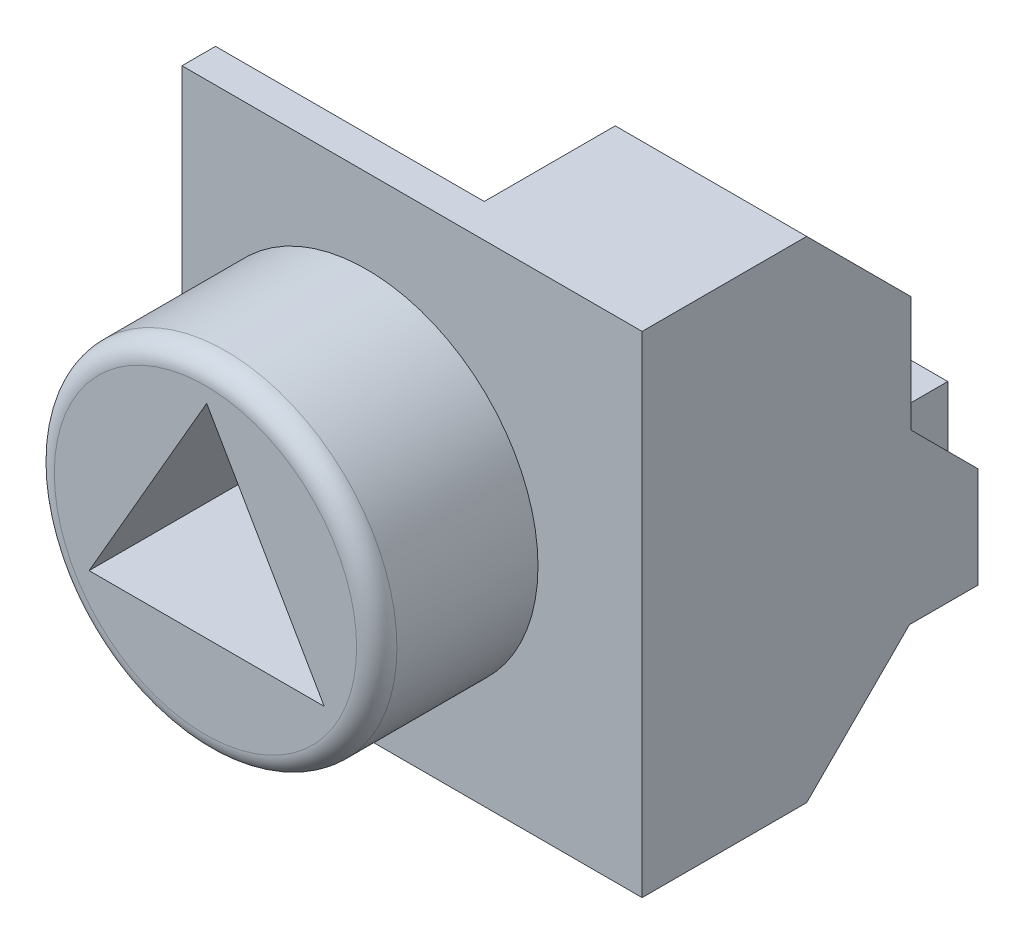
from build123d import *

# Parameters (mm, degrees)
SKETCH_2_R          = 5.1
EXTRUDE_1_DEPTH     = 4.8
SKETCH_3_W          = 11
SKETCH_3_H          = 14.6
EXTRUDE_2_DEPTH     = 1
SKETCH_4_R          = 1.5
EXTRUDE_3_DEPTH     = 10.8
CUT_EXTRUDE_1_DEPTH = 10.8
FILLET_1_R          = 0.6
CUT_EXTRUDE_2_DEPTH = 4.8
SKETCH_7_R          = 1
CUT_EXTRUDE_3_DEPTH = 1
SKETCH_8_W          = 3
SKETCH_8_H          = 14.6
EXTRUDE_4_DEPTH     = 7
CHAMFER_1_SIZE      = 3.1
SKETCH_9_W          = 2.584868303
SKETCH_9_H          = 3
EXTRUDE_5_DEPTH     = 10
CHAMFER_3_SIZE      = 2
CHAMFER_4_SIZE      = 2
EXTRUDE_6_DEPTH     = 2.7


with BuildPart() as part:
    # Эскиз2 → Бобышка-Вытянуть1 (new body)
    with BuildSketch(Plane.XY):
        with Locations((0, 9.48)):
            Circle(SKETCH_2_R)
    extrude(amount=EXTRUDE_1_DEPTH)

    # Эскиз3 → Бобышка-Вытянуть2 (add)
    with BuildSketch(Plane(origin=(0, 0, 0), x_dir=(-1, 0, 0), z_dir=(0, 0, -1))):
        with Locations((0, 9.78)):
            Rectangle(SKETCH_3_W, SKETCH_3_H)
    extrude(amount=EXTRUDE_2_DEPTH)

    # Эскиз4 → Бобышка-Вытянуть3 (add)
    with BuildSketch(Plane(origin=(0, 0, -1), x_dir=(-1, 0, 0), z_dir=(0, 0, -1))):
        with Locations(Location((-4.415131697, 7.038465404, 0), (0, 0, 223.676907922))):
            Circle(SKETCH_4_R)
    extrude(amount=EXTRUDE_3_DEPTH)

    # Эскиз5 → Вырез-Вытянуть1 (cut)
    with BuildSketch(Plane.XY.offset(-1)):
        with BuildLine():
            Line((5.5, 8.074351868), (5.5, 6.002578941))
            ThreePointArc((5.5, 6.002578941), (5.915131697, 7.038465404), (5.5, 8.074351868))
        make_face()
    extrude(amount=-CUT_EXTRUDE_1_DEPTH, mode=Mode.SUBTRACT)

    # Скругление1
    fillet_1_edges = [part.edges().sort_by_distance(p)[0] for p in [
        (-5.1, 9.48, 4.8),
    ]]
    fillet(fillet_1_edges, radius=FILLET_1_R)

    # Эскиз6 → Вырез-Вытянуть2 (cut)
    with BuildSketch(Plane.XY.offset(4.8)):
        Polygon((0.035898385, 13.542177826), (-3.464101615, 7.48), (3.535898385, 7.48), align=None)
    extrude(amount=-CUT_EXTRUDE_2_DEPTH, mode=Mode.SUBTRACT)

    # Эскиз7 → Вырез-Вытянуть3 (cut)
    with BuildSketch(Plane.XY):
        with Locations((0, 9.48)):
            Circle(SKETCH_7_R)
    extrude(amount=-CUT_EXTRUDE_3_DEPTH, mode=Mode.SUBTRACT)

    # Эскиз8 → Бобышка-Вытянуть4 (add)
    with BuildSketch(Plane(origin=(0, 0, -1), x_dir=(-1, 0, 0), z_dir=(0, 0, -1))):
        with Locations((-4, 9.78)):
            Rectangle(SKETCH_8_W, SKETCH_8_H)
    extrude(amount=EXTRUDE_4_DEPTH)

    # Фаска1
    # the kernel refuses this chamfer: 3.1 mm, written as the material it takes off along each edge
    with BuildSketch(Plane(origin=(-5.472217263, 2.48, -8), x_dir=(0, -0.027495876610586382, 0.9996219169112966), z_dir=(1, 0, 0))) as chamfer_1_piece_1_section:
        Polygon((CHAMFER_1_SIZE * 0.999621916911, -CHAMFER_1_SIZE * 0.0274958766106), (-CHAMFER_1_SIZE * 0.0274958766106, -CHAMFER_1_SIZE * 0.999621916911), (0, 0), align=None)
    chamfer_1_piece_1 = extrude(amount=18.944434525, mode=Mode.PRIVATE)
    chamfer_1_piece_1 = chamfer_1_piece_1 - Plane(origin=(4.415131697, 7.038465404, -6.977511347), x_dir=(0.7232455354515278, -0.6905909755053515, 0), z_dir=(0, 0, 1)) * Cylinder(1.5, 51, mode=Mode.PRIVATE)
    add(chamfer_1_piece_1, mode=Mode.SUBTRACT)
    with BuildSketch(Plane(origin=(13.472217263, 17.08, -8), x_dir=(0, -0.9996219169112966, -0.027495876610586514), z_dir=(-1, 0, 0))) as chamfer_1_piece_2:
        Polygon((CHAMFER_1_SIZE * 0.999621916911, CHAMFER_1_SIZE * 0.0274958766106), (-CHAMFER_1_SIZE * 0.0274958766106, CHAMFER_1_SIZE * 0.999621916911), (0, 0), align=None)
    extrude(amount=18.944434525, mode=Mode.SUBTRACT)

    # Эскиз9 → Бобышка-Вытянуть5 (add)
    with BuildSketch(Plane(origin=(0, 0, -11.8), x_dir=(-1, 0, 0), z_dir=(0, 0, -1))):
        with Locations((-4.207565848, 7.038465404)):
            Rectangle(SKETCH_9_W, SKETCH_9_H)
    extrude(amount=-EXTRUDE_5_DEPTH)

    # Фаска3
    chamfer_3_edges = [part.edges().sort_by_distance(p)[0] for p in [
        (4.207565848, 8.538465404, -8),
    ]]
    chamfer(chamfer_3_edges, length=CHAMFER_3_SIZE)

    # Фаска4
    # the kernel refuses this chamfer: 2 mm, written as the material it adds along each edge
    with BuildSketch(Plane(origin=(2.915131697, 15.68183138, -8), x_dir=(-0.9996219169112968, 6.965053790802993e-15, 0.027495876610586487), z_dir=(0, -1, 0))) as chamfer_4_piece_1_section:
        Polygon((CHAMFER_4_SIZE * 0.999621916911, CHAMFER_4_SIZE * 0.0274958766106), (-CHAMFER_4_SIZE * 0.0274958766106, CHAMFER_4_SIZE * 0.999621916911), (0, 0), align=None)
    chamfer_4_piece_1 = extrude(amount=15.245197356, mode=Mode.PRIVATE)
    chamfer_4_piece_1 = split(chamfer_4_piece_1, bisect_by=Plane(origin=(2.5, 9.220354444, -8.636221921), z_dir=(1, 0, 0)), keep=Keep.TOP, mode=Mode.PRIVATE)
    chamfer_4_piece_1 = split(chamfer_4_piece_1, bisect_by=Plane(origin=(2.728922141, 9.561298963, -8.977166441), z_dir=(0, -0.7071067811865476, 0.7071067811865476)), keep=Keep.TOP, mode=Mode.PRIVATE)
    chamfer_4_piece_1 = split(chamfer_4_piece_1, bisect_by=Plane(origin=(2.728922141, 8.538465404, -8.636221921), z_dir=(0, 1, 0)), keep=Keep.TOP, mode=Mode.PRIVATE)
    add(chamfer_4_piece_1)
    with BuildSketch(Plane(origin=(2.915131697, 15.68183138, -8), x_dir=(-0.9996219169112968, 6.965053790802993e-15, 0.027495876610586487), z_dir=(0, -1, 0))) as chamfer_4_piece_2_section:
        Polygon((CHAMFER_4_SIZE * 0.999621916911, CHAMFER_4_SIZE * 0.0274958766106), (-CHAMFER_4_SIZE * 0.0274958766106, CHAMFER_4_SIZE * 0.999621916911), (0, 0), align=None)
    chamfer_4_piece_2 = extrude(amount=15.245197356, mode=Mode.PRIVATE)
    chamfer_4_piece_2 = split(chamfer_4_piece_2, bisect_by=Plane(origin=(2.5, 7.443880943, -8.769342974), z_dir=(1, 0, 0)), keep=Keep.TOP, mode=Mode.PRIVATE)
    chamfer_4_piece_2 = split(chamfer_4_piece_2, bisect_by=Plane(origin=(2.735166787, 6.896611958, -9.316611958), z_dir=(0, 0.7071067811862648, 0.7071067811868302)), keep=Keep.TOP, mode=Mode.PRIVATE)
    chamfer_4_piece_2 = split(chamfer_4_piece_2, bisect_by=Plane(origin=(2.735166787, 8.606501686, -9.931963718), z_dir=(0, -0.7071067811865476, 0.7071067811865476)), keep=Keep.TOP, mode=Mode.PRIVATE)
    chamfer_4_piece_2 = split(chamfer_4_piece_2, bisect_by=Plane(origin=(2.735166787, 8.538465404, -8.769342974), z_dir=(0, -1, 0)), keep=Keep.TOP, mode=Mode.PRIVATE)
    add(chamfer_4_piece_2)

    # Эскиз10 → Бобышка-Вытянуть6 (add)
    with BuildSketch(Plane(origin=(5.5, 0, 0), x_dir=(0, 0, -1), z_dir=(1, 0, 0))):
        Polygon((10, 5.538465404), (10, 8.538465404), (8, 10.538465404), (8, 13.98), (4.9, 17.08), (0, 17.08), (0, 2.48), (4.9, 2.48), (7.958465404, 5.538465404), align=None)
    extrude(amount=EXTRUDE_6_DEPTH)


solid = part.part
